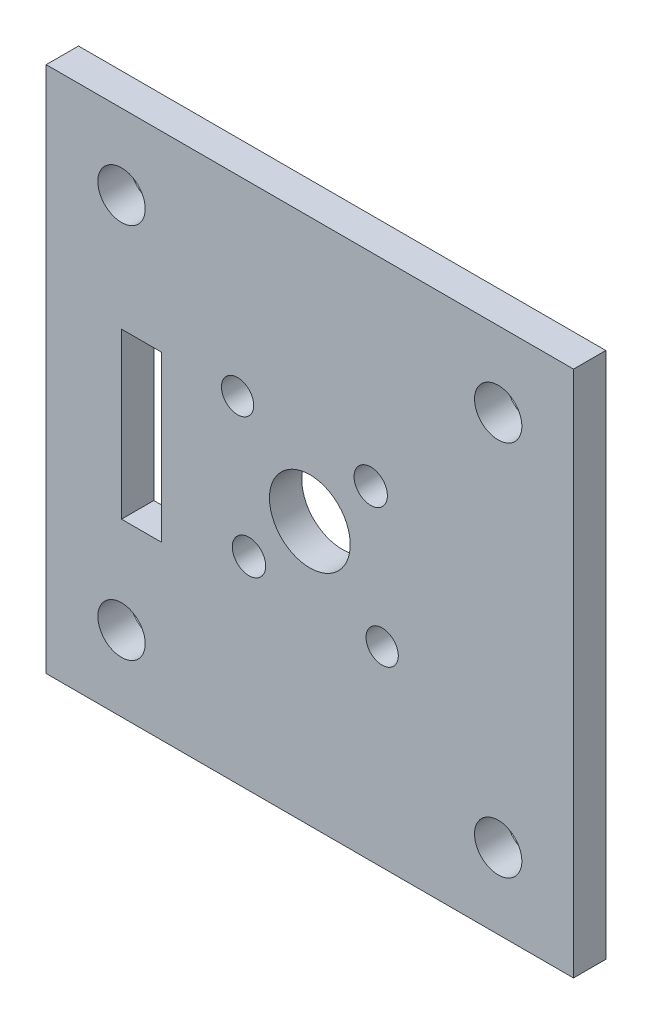
from build123d import *

# Parameters (mm, degrees)
SKETCH1_W           = 49
SKETCH1_H           = 49
SKETCH1_R           = 2.2
BOSS_EXTRUDE1_DEPTH = 3
SKETCH2_R           = 1.55
SKETCH2_R_2         = 1.5
SKETCH2_R_3         = 3.753598576
SKETCH2_W           = 3.699471197
SKETCH2_H           = 15.29419199
CUT_EXTRUDE1_DEPTH  = 3


with BuildPart() as part:
    # Sketch1 → Boss-Extrude1 (new body)
    with BuildSketch(Plane.XY):
        Rectangle(SKETCH1_W, SKETCH1_H)
        with Locations((-17.5, -17.5)):
            Circle(SKETCH1_R, mode=Mode.SUBTRACT)
        with Locations((17.5, -17.5)):
            Circle(SKETCH1_R, mode=Mode.SUBTRACT)
        with Locations((-17.5, 17.5)):
            Circle(SKETCH1_R, mode=Mode.SUBTRACT)
        with Locations((17.5, 17.5)):
            Circle(SKETCH1_R, mode=Mode.SUBTRACT)
    extrude(amount=BOSS_EXTRUDE1_DEPTH)

    # Sketch2 → Cut-Extrude1 (cut)
    with BuildSketch(Plane(origin=(0, 0, 0), x_dir=(-1, 0, 0), z_dir=(0, 0, -1))):
        with Locations((-5.656854249, 5.656854249)):
            Circle(SKETCH2_R)
        with Locations((6.717514421, 6.717514421)):
            Circle(SKETCH2_R_2)
        with Locations((5.656854249, -5.656854249)):
            Circle(SKETCH2_R)
        with Locations((-6.717514421, -6.717514421)):
            Circle(SKETCH2_R_2)
        Circle(SKETCH2_R_3)
        with Locations((15.650264401, -0.929581574)):
            Rectangle(SKETCH2_W, SKETCH2_H)
    extrude(amount=-CUT_EXTRUDE1_DEPTH, mode=Mode.SUBTRACT)


solid = part.part
